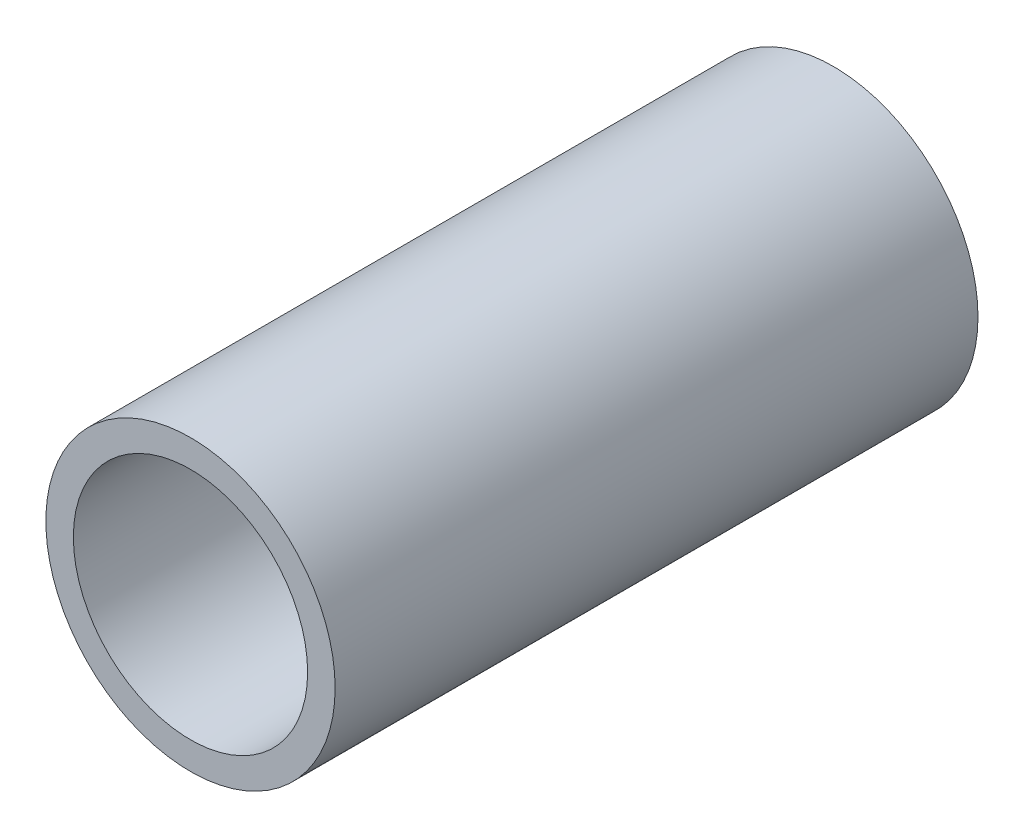
from build123d import *

# Parameters (mm, degrees)
SKETCH1_R           = 18
BOSS_EXTRUDE1_DEPTH = 80
SKETCH2_R           = 14.576002813
CUT_EXTRUDE1_DEPTH  = 60
SKETCH3_R           = 4.364419647
CUT_EXTRUDE2_DEPTH  = 60


with BuildPart() as part:
    # Sketch1 → Boss-Extrude1 (new body)
    with BuildSketch(Plane.XY):
        Circle(SKETCH1_R)
    extrude(amount=BOSS_EXTRUDE1_DEPTH)

    # Sketch2 → Cut-Extrude1 (cut)
    with BuildSketch(Plane.XY.offset(80)):
        Circle(SKETCH2_R)
    extrude(amount=-CUT_EXTRUDE1_DEPTH, mode=Mode.SUBTRACT)

    # Sketch3 → Cut-Extrude2 (cut)
    with BuildSketch(Plane(origin=(0, 0, 0), x_dir=(-1, 0, 0), z_dir=(0, 0, -1))):
        Circle(SKETCH3_R)
    extrude(amount=-CUT_EXTRUDE2_DEPTH, mode=Mode.SUBTRACT)


solid = part.part
